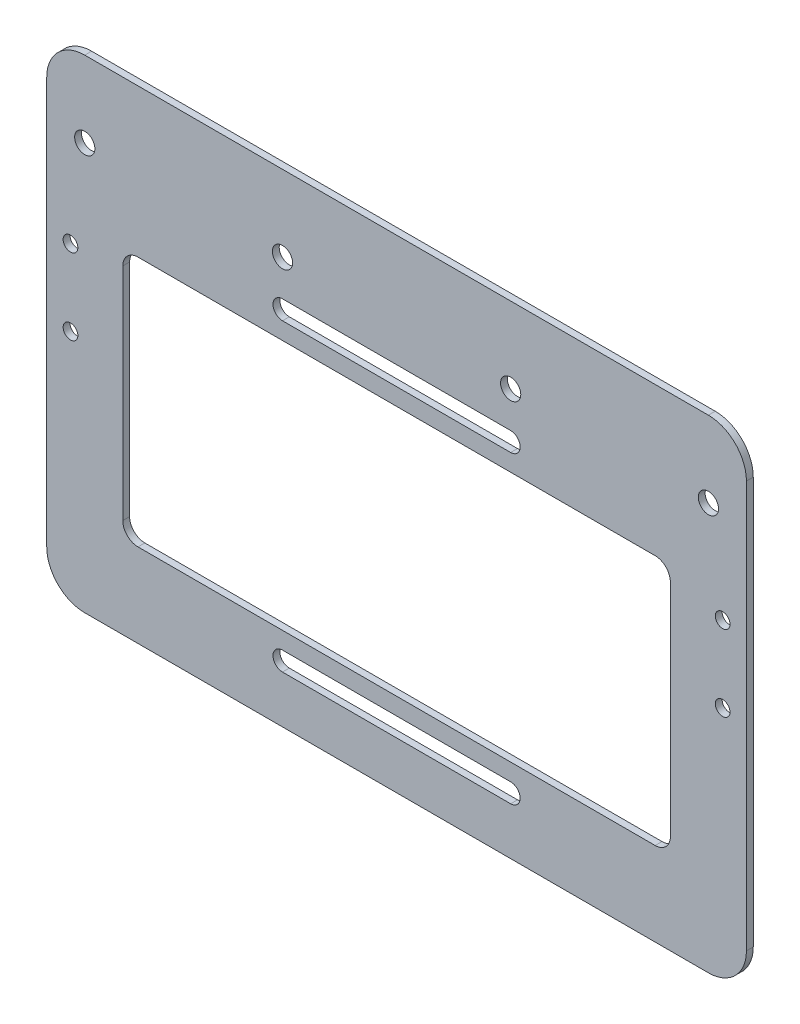
from build123d import *

# Parameters (mm, degrees)
SKETCH1_W                    = 233.68
SKETCH1_H                    = 161.29
BOSS_EXTRUDE1_DEPTH          = 2.286
CUT_EXTRUDE1_DEPTH           = 142.987419939
F_1_4_CLEARANCE_HOLE1_D      = 6.7564
F_1_4_CLEARANCE_HOLE2_D      = 6.7564
F_10_0_1935_DIAMETER_HOLE1_D = 4.9149
FILLET1_R                    = 12.7


with BuildPart() as part:
    # Sketch1 → Boss-Extrude1 (new body)
    with BuildSketch(Plane.XY):
        Rectangle(SKETCH1_W, SKETCH1_H)
        with BuildLine():
            Line((-86.36, 31.115), (86.36, 31.115))
            ThreePointArc((86.36, 31.115), (89.952102448, 29.627102448), (91.44, 26.035))
            Line((91.44, 26.035), (91.44, -47.625))
            ThreePointArc((91.44, -47.625), (89.952102448, -51.217102448), (86.36, -52.705))
            Line((86.36, -52.705), (-86.36, -52.705))
            ThreePointArc((-86.36, -52.705), (-89.952102448, -51.217102448), (-91.44, -47.625))
            Line((-91.44, -47.625), (-91.44, 26.035))
            ThreePointArc((-91.44, 26.035), (-89.952102448, 29.627102448), (-86.36, 31.115))
        make_face(mode=Mode.SUBTRACT)
    extrude(amount=BOSS_EXTRUDE1_DEPTH)

    # Sketch2 → Cut-Extrude1 (cut, through all)
    with BuildSketch(Plane.XY.offset(2.286)):
        with BuildLine():
            Line((38.1, 36.83), (-38.1, 36.83))
            ThreePointArc((-38.1, 36.83), (-41.275, 40.005), (-38.1, 43.18))
            Line((-38.1, 43.18), (38.1, 43.18))
            ThreePointArc((38.1, 43.18), (41.275, 40.005), (38.1, 36.83))
        make_face()
        with BuildLine():
            Line((38.1, -58.42), (-38.1, -58.42))
            ThreePointArc((-38.1, -58.42), (-41.275, -61.595), (-38.1, -64.77))
            Line((-38.1, -64.77), (38.1, -64.77))
            ThreePointArc((38.1, -64.77), (41.275, -61.595), (38.1, -58.42))
        make_face()
    extrude(amount=-CUT_EXTRUDE1_DEPTH, mode=Mode.SUBTRACT)

    # 1/4 Clearance Hole1 (through all)
    with Locations(Plane.XY.offset(2.286)):
        with Locations((-38.1, 55.245), (38.1, 55.245)):
            Hole(F_1_4_CLEARANCE_HOLE1_D / 2)

    # 1/4 Clearance Hole2 (through all)
    with Locations(Plane.XY.offset(2.286)):
        with Locations((-104.14, 55.245), (104.14, 55.245)):
            Hole(F_1_4_CLEARANCE_HOLE2_D / 2)

    # #10 (0.1935) Diameter Hole1 (through all)
    with Locations(Plane.XY.offset(2.286)):
        with Locations((-108.9025, 23.749), (-108.9025, -1.651)):
            f_10_0_1935_diameter_hole1 = Hole(F_10_0_1935_DIAMETER_HOLE1_D / 2)

    # Mirror1: #10 (0.1935) Diameter Hole1 across plane
    add(f_10_0_1935_diameter_hole1.mirror(Plane(origin=(0, 0, 0), x_dir=(0, 0, 1), z_dir=(1, 0, 0))), mode=Mode.SUBTRACT)

    # Fillet1
    fillet1_edges = [part.edges().sort_by_distance(p)[0] for p in [
        (-116.84, 80.645, 1.143),
        (116.84, 80.645, 1.143),
        (-116.84, -80.645, 1.143),
        (116.84, -80.645, 1.143),
    ]]
    fillet(fillet1_edges, radius=FILLET1_R)


solid = part.part
